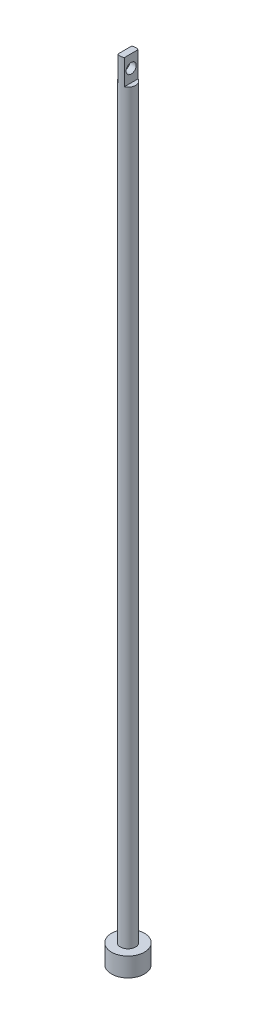
from build123d import *

# Parameters (mm, degrees)
SKETCH_1_R           = 13
EXTRUDE_1_DEPTH      = 15
SKETCH_2_R           = 6
EXTRUDE_2_DEPTH      = 610
SKETCH_3_OUTSIDE_W   = 153.216
SKETCH_3_OUTSIDE_H   = 153.216
SKETCH_3_OUTSIDE_W_2 = 5
SKETCH_3_OUTSIDE_H_2 = 20
CUT_EXTRUDE_1_DEPTH  = 20
SKETCH_4_R           = 4
CUT_EXTRUDE_2_DEPTH  = 20


with BuildPart() as part:
    # 草图1 → 凸台-拉伸1 (new body)
    with BuildSketch(Plane(origin=(0, 0, 0), x_dir=(1, 0, 0), z_dir=(0, 1, 0))):
        Circle(SKETCH_1_R)
    extrude(amount=EXTRUDE_1_DEPTH)

    # 草图2 → 凸台-拉伸2 (add)
    with BuildSketch(Plane(origin=(0, 15, 0), x_dir=(1, 0, 0), z_dir=(0, 1, 0))):
        Circle(SKETCH_2_R)
    extrude(amount=EXTRUDE_2_DEPTH)

    # 草图3 outside → 切除-拉伸1 (cut)
    with BuildSketch(Plane(origin=(0, 625, 0), x_dir=(1, 0, 0), z_dir=(0, 1, 0))):
        Rectangle(SKETCH_3_OUTSIDE_W, SKETCH_3_OUTSIDE_H)
        Rectangle(SKETCH_3_OUTSIDE_W_2, SKETCH_3_OUTSIDE_H_2, mode=Mode.SUBTRACT)
    extrude(amount=-CUT_EXTRUDE_1_DEPTH, mode=Mode.SUBTRACT)

    # 草图4 → 切除-拉伸2 (cut)
    with BuildSketch(Plane.ZY.offset(2.5)):
        with Locations((0, 615)):
            Circle(SKETCH_4_R)
    extrude(amount=-CUT_EXTRUDE_2_DEPTH, mode=Mode.SUBTRACT)


solid = part.part
